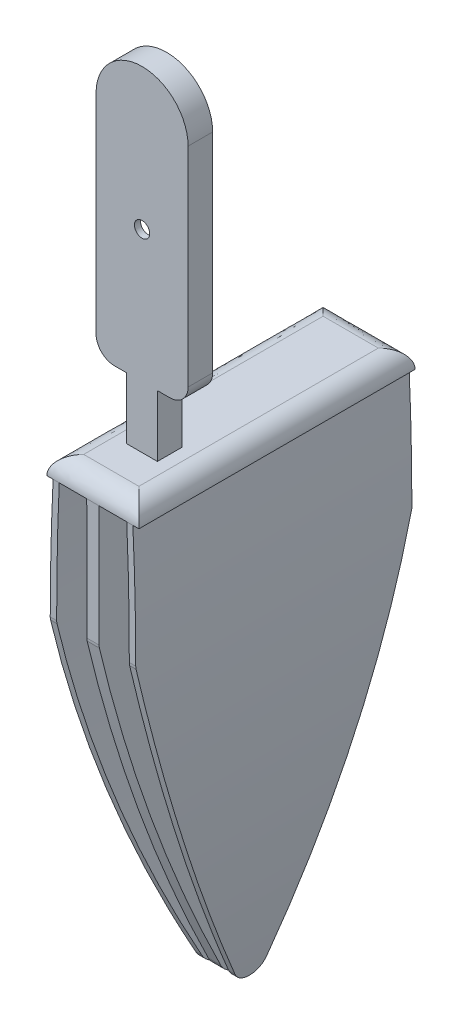
from build123d import *
from OCP.BRepAlgoAPI import BRepAlgoAPI_Cut
from OCP.TopTools import TopTools_ListOfShape

# Parameters (mm, degrees)
EXTRUDE_1_DEPTH          = 2
EXTRUDE_1_DEPTH_BACK     = 2
EXTRUDE_2_DEPTH          = 7.5
EXTRUDE_2_DEPTH_BACK     = 7.5
EXTRUDE_4_DEPTH          = 1
EXTRUDE_4_DEPTH_BACK     = 1
EXTRUDE_8_DEPTH          = 28
EXTRUDE_8_DEPTH_BACK     = 17
SKETCH_21_W              = 5
SKETCH_21_H              = 10
CUT_EXTRUDE_4_DEPTH      = 4
CUT_EXTRUDE_5_DEPTH      = 1
CUT_EXTRUDE_5_DEPTH_BACK = 2
SKETCH_23_R              = 1.25
CUT_EXTRUDE_6_DEPTH      = 13
CUT_EXTRUDE_8_DEPTH      = 10
CUT_EXTRUDE_8_DEPTH_BACK = 10
FILLET_25_R              = 3
FILLET_26_R              = 2.75
FILLET_27_R              = 2.75
FILLET_30_R              = 2.75
FILLET_31_R              = 2.75
FILLET_35_R              = 3
FILLET_36_R              = 3
FILLET_START             = -36
FILLET_37_DEPTH          = 47
FILLET_START_2           = -9
FILLET_38_DEPTH          = 18
FILLET_39_R              = 3
FILLET_40_R              = 3
FILLET_43_R              = 2
FILLET_44_R              = 2
FILLET_45_R              = 2
FILLET_46_R              = 2
FILLET_47_R              = 2
FILLET_48_R              = 2


with BuildPart() as part:
    # 草圖1 → 填料-伸長1 (new, two sides: drawn at the far end of the back side and taken through both)
    with BuildSketch(Plane.XY.offset(-EXTRUDE_1_DEPTH_BACK)):
        with BuildLine():
            Line((7.5, 8), (7.5, 55))
            ThreePointArc((7.5, 55), (0, 62.5), (-7.5, 55))
            Line((-7.5, 55), (-7.5, 8))
            Line((-7.5, 8), (7.5, 8))
        make_face()
    extrude(amount=EXTRUDE_1_DEPTH + EXTRUDE_1_DEPTH_BACK)

    # 草圖6 → 填料-伸長2 (add, two sides: drawn at the far end of the back side and taken through both)
    with BuildSketch(Plane(origin=(0, 0, 0), x_dir=(0, 0, -1), z_dir=(1, 0, 0)).offset(-EXTRUDE_2_DEPTH_BACK)):
        Polygon((-2.016989482, 8), (35, 8), (35, 5), (-2, 5), (-10.016989482, 5), (-10.016989482, 8), align=None)
    extrude(amount=EXTRUDE_2_DEPTH + EXTRUDE_2_DEPTH_BACK)

    # 草圖19 → 填料-伸長8 (add, two sides: drawn at the far end of the back side and taken through both)
    with BuildSketch(Plane.XY.offset(-18).offset(-EXTRUDE_8_DEPTH_BACK)):
        with BuildLine():
            Line((6.5, 5), (5.5, 5))
            ThreePointArc((5.5, 5), (5.47282517, -33.328822067), (2, -71.5))
            Line((2, -71.5), (3, -71.5))
            ThreePointArc((3, -71.5), (6.537897336, -33.331799225), (6.5, 5))
        make_face()
        with BuildLine():
            Line((-3, -71.5), (-2, -71.5))
            ThreePointArc((-2, -71.5), (-5.47282517, -33.328822067), (-5.5, 5))
            Line((-5.5, 5), (-6.5, 5))
            ThreePointArc((-6.5, 5), (-6.537897336, -33.331799225), (-3, -71.5))
        make_face()
    extrude(amount=EXTRUDE_8_DEPTH + EXTRUDE_8_DEPTH_BACK)

    # 草圖21 → 除料-伸長4 (cut)
    with BuildSketch(Plane.XY.offset(2)):
        with Locations((-5, 13)):
            Rectangle(SKETCH_21_W, SKETCH_21_H)
        with Locations((5, 13)):
            Rectangle(SKETCH_21_W, SKETCH_21_H)
    extrude(amount=-CUT_EXTRUDE_4_DEPTH, mode=Mode.SUBTRACT)

    # 草圖3 → 除料-伸長5 (cut, two sides: drawn at the far end of the back side and taken through both)
    with BuildSketch(Plane.XY.offset(-CUT_EXTRUDE_5_DEPTH_BACK)):
        with BuildLine():
            Line((-2.106194146, 57.35480611), (-4.932538983, 40.323847539))
            ThreePointArc((-4.932538983, 40.323847539), (-5, 39.50527611), (-4.932538983, 38.686704682))
            Line((-4.932538983, 38.686704682), (-2.106194146, 21.65574611))
            ThreePointArc((-2.106194146, 21.65574611), (0, 19.87027611), (2.106194146, 21.65574611))
            Line((2.106194146, 21.65574611), (4.932538983, 38.686704682))
            ThreePointArc((4.932538983, 38.686704682), (5, 39.50527611), (4.932538983, 40.323847539))
            Line((4.932538983, 40.323847539), (2.106194146, 57.35480611))
            ThreePointArc((2.106194146, 57.35480611), (0, 59.14027611), (-2.106194146, 57.35480611))
        make_face()
    extrude(amount=CUT_EXTRUDE_5_DEPTH + CUT_EXTRUDE_5_DEPTH_BACK, mode=Mode.SUBTRACT)

    # 草圖23 → 除料-伸長6 (cut)
    with BuildSketch(Plane(origin=(0, 0, -2), x_dir=(-1, 0, 0), z_dir=(0, 0, -1))):
        with Locations((0, 39.50527611)):
            Circle(SKETCH_23_R)
    extrude(amount=-CUT_EXTRUDE_6_DEPTH, mode=Mode.SUBTRACT)


with BuildPart() as body_2:
    # 草圖8 → 填料-伸長4 (new, two sides: drawn at the far end of the back side and taken through both)
    with BuildSketch(Plane(origin=(0, 0, 0), x_dir=(0, 0, -1), z_dir=(1, 0, 0)).offset(-EXTRUDE_4_DEPTH_BACK)):
        with BuildLine():
            Line((-9.999998743, -14.904722772), (-10.016989482, 5))
            Line((-10.016989482, 5), (35, 5))
            Line((35, 5), (35, -14.904722772))
            ThreePointArc((35, -14.904722772), (25.650331721, -45.663855824), (12.500000628, -75))
            ThreePointArc((12.500000628, -75), (-0.650330465, -45.663855824), (-9.999998743, -14.904722772))
        make_face()
    extrude(amount=EXTRUDE_4_DEPTH + EXTRUDE_4_DEPTH_BACK)

    # 圓角25
    fillet_25_edges = [body_2.edges().sort_by_distance(p)[0] for p in [
        (0, -75, -12.500000628),
    ]]
    fillet(fillet_25_edges, radius=FILLET_25_R)

    # 圓角43
    fillet_43_edges = [body_2.edges().sort_by_distance(p)[0] for p in [
        (0, -14.904722772, 9.999998743),
    ]]
    fillet(fillet_43_edges, radius=FILLET_43_R)

    # 圓角47
    fillet_47_edges = [body_2.edges().sort_by_distance(p)[0] for p in [
        (0, -14.904722772, -35),
    ]]
    fillet(fillet_47_edges, radius=FILLET_47_R)


with BuildPart() as cut_extrude_8_tool:
    # 草圖24 → 除料-伸長8 (new, two sides: drawn at the far end of the back side and taken through both)
    with BuildSketch(Plane(origin=(0, 0, 0), x_dir=(0, 0, -1), z_dir=(1, 0, 0)).offset(-CUT_EXTRUDE_8_DEPTH_BACK)):
        with BuildLine():
            ThreePointArc((35, -14.904722772), (25.693794366, -45.547685247), (12.615451118, -74.780433159))
            Line((12.615451118, -74.780433159), (12.613664206, -75))
            Line((12.613664206, -75), (35, -75))
            Line((35, -75), (35, -14.904722772))
        make_face()
        with BuildLine():
            ThreePointArc((-9.999998743, -14.904722772), (-0.650330465, -45.663855824), (12.500000628, -75))
            Line((12.500000628, -75), (-9.999998743, -75))
            Line((-9.999998743, -75), (-9.999998743, -14.904722772))
        make_face()
    extrude(amount=CUT_EXTRUDE_8_DEPTH + CUT_EXTRUDE_8_DEPTH_BACK)


with BuildPart() as part_1:
    add(part.part)

    # 除料-伸長8: cut by cut_extrude_8_tool, with a tolerance
    cut_extrude_8_stock = TopTools_ListOfShape()
    cut_extrude_8_stock.Append(part_1.part.wrapped)
    cut_extrude_8_tools = TopTools_ListOfShape()
    cut_extrude_8_tools.Append(cut_extrude_8_tool.part.wrapped)
    cut_extrude_8_cut = BRepAlgoAPI_Cut()
    cut_extrude_8_cut.SetArguments(cut_extrude_8_stock)
    cut_extrude_8_cut.SetTools(cut_extrude_8_tools)
    cut_extrude_8_cut.SetFuzzyValue(0.00001)
    cut_extrude_8_cut.Build()
    add(Compound.cast(cut_extrude_8_cut.Shape()).solids(), mode=Mode.REPLACE)

    # 圓角26
    fillet_26_edges = [part_1.edges().sort_by_distance(p)[0] for p in [
        (-2.5, -71.5, -10.691921304),
    ]]
    fillet(fillet_26_edges, radius=FILLET_26_R)

    # 圓角27
    fillet_27_edges = [part_1.edges().sort_by_distance(p)[0] for p in [
        (-2.5, -71.5, -14.308079953),
    ]]
    fillet(fillet_27_edges, radius=FILLET_27_R)

    # 圓角30
    fillet_30_edges = [part_1.edges().sort_by_distance(p)[0] for p in [
        (2.5, -71.5, -10.691921304),
    ]]
    fillet(fillet_30_edges, radius=FILLET_30_R)

    # 圓角31
    fillet_31_edges = [part_1.edges().sort_by_distance(p)[0] for p in [
        (2.5, -71.5, -14.308079953),
    ]]
    fillet(fillet_31_edges, radius=FILLET_31_R)

    # 圓角35
    fillet_35_edges = [part_1.edges().sort_by_distance(p)[0] for p in [
        (7.5, 8, -12.491505259),
    ]]
    fillet(fillet_35_edges, radius=FILLET_35_R - 0.0001)  # a hair under: the kernel refuses the full size

    # 圓角36
    # the kernel refuses this fillet: 3 mm, written as the material it takes off along each edge
    with BuildSketch(Plane(origin=(-15, 8, 10.016989482), x_dir=(0, 0, -1), z_dir=(1, 0, 0))) as fillet_36_piece_1:
        with BuildLine():
            CenterArc((FILLET_36_R, -FILLET_36_R), FILLET_36_R, 90, 90)
            Line((0, -FILLET_36_R), (0, 0))
            Line((0, 0), (FILLET_36_R, 0))
        make_face()
    extrude(amount=27.0001, mode=Mode.SUBTRACT)

    # 圓角37: read off the stored shape, not the designer's step
    # 圓角37 outline → 圓角37 (cut)
    with BuildSketch(Plane.XY.offset(FILLET_START)):
        with BuildLine():
            add(Edge.make_bspline(
                [(-4.5, 8), (-7.5, 8), (-7.5, 5)],
                knots=[0, 0, 0, 1, 1, 1], degree=2, weights=[1, 0.707106781, 1]))
            Line((-4.5, 8), (-7.5, 8))
            Line((-7.5, 8), (-7.5, 5))
        make_face()
    extrude(amount=FILLET_37_DEPTH, mode=Mode.SUBTRACT)

    # 圓角38: read off the stored shape, not the designer's step
    # 圓角38 outline → 圓角38 (cut)
    with BuildSketch(Plane.YZ.offset(FILLET_START_2)):
        with BuildLine():
            add(Edge.make_bspline(
                [(5, -35), (8, -35), (8, -32)],
                knots=[0, 0, 0, 1, 1, 1], degree=2, weights=[1, 0.707106781, 1]))
            Line((5, -35), (8, -35))
            Line((8, -35), (8, -32))
        make_face()
    extrude(amount=FILLET_38_DEPTH, mode=Mode.SUBTRACT)

    # 圓角39
    fillet_39_edges = [part_1.edges().sort_by_distance(p)[0] for p in [
        (-7.5, 18, 0),
    ]]
    fillet(fillet_39_edges, radius=FILLET_39_R)

    # 圓角40
    fillet_40_edges = [part_1.edges().sort_by_distance(p)[0] for p in [
        (7.5, 18, 0),
    ]]
    fillet(fillet_40_edges, radius=FILLET_40_R)

    # 圓角44
    fillet_44_edges = [part_1.edges().sort_by_distance(p)[0] for p in [
        (6.441659955, -14.904722772, 9.999998743),
    ]]
    fillet(fillet_44_edges, radius=FILLET_44_R)

    # 圓角45
    fillet_45_edges = [part_1.edges().sort_by_distance(p)[0] for p in [
        (-6.441659955, -14.904722772, 9.999998743),
    ]]
    fillet(fillet_45_edges, radius=FILLET_45_R)

    # 圓角46
    fillet_46_edges = [part_1.edges().sort_by_distance(p)[0] for p in [
        (-6.441659955, -14.904722772, -35),
    ]]
    fillet(fillet_46_edges, radius=FILLET_46_R)

    # 圓角48
    fillet_48_edges = [part_1.edges().sort_by_distance(p)[0] for p in [
        (6.441659955, -14.904722772, -35),
    ]]
    fillet(fillet_48_edges, radius=FILLET_48_R)


solid = Compound([body_2.part, part_1.part])
